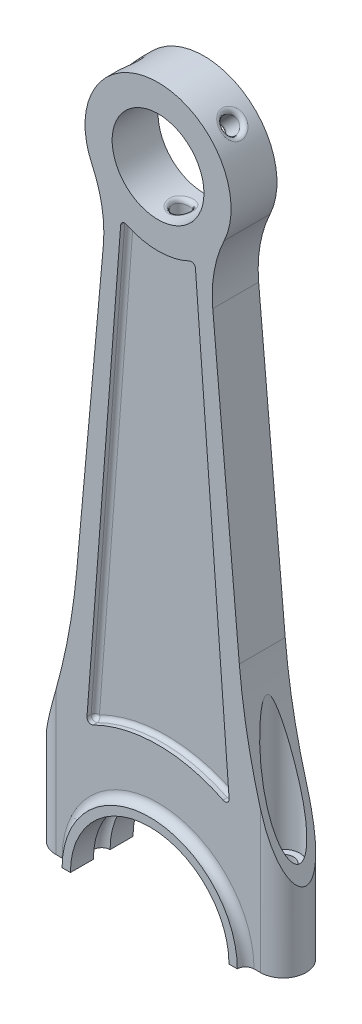
from build123d import *

# Parameters (mm, degrees)
SKETCH1_R               = 11
BOSS_EXTRUDE1_DEPTH     = 11
CUT_EXTRUDE1_START      = -2
CUT_EXTRUDE1_DEPTH      = 2
SKETCH3_R               = 2.5
CUT_EXTRUDE2_DEPTH      = 176.434460697
CUT_EXTRUDE3_START      = -20
SKETCH4_R               = 4
CUT_EXTRUDE3_DEPTH      = 156.43446072
BOSS_EXTRUDE2_DEPTH     = 2
FILLET1_R               = 2
SKETCH7_R               = 2
CUT_EXTRUDE4_REACH      = 177.571
CUT_EXTRUDE4_END_RADIUS = 11
SKETCH8_R               = 2
FILLET2_R               = 1
FILLET3_R               = 1
FILLET4_START           = -1
FILLET4_DEPTH           = 62.521512365
FILLET5_START           = -1
FILLET5_DEPTH           = 62.521512365


with BuildPart() as part:
    # Sketch1 → Boss-Extrude1 (new body)
    with BuildSketch(Plane.XY):
        with BuildLine():
            Line((30, 0), (30, 18))
            ThreePointArc((30, 18), (23.132621818, 39.37253177), (19.476303949, 61.521512265))
            Line((19.476303949, 61.521512265), (13.110138567, 132.100780215))
            ThreePointArc((13.110138567, 132.100780215), (13.445465667, 140.010108931), (15.837993998, 147.556348604))
            ThreePointArc((15.837993998, 147.556348604), (0, 172.5), (-15.837993998, 147.556348604))
            ThreePointArc((-15.837993998, 147.556348604), (-13.445465667, 140.010108931), (-13.110138567, 132.100780215))
            Line((-13.110138567, 132.100780215), (-19.476303949, 61.521512265))
            ThreePointArc((-19.476303949, 61.521512265), (-23.132621818, 39.37253177), (-30, 18))
            Line((-30, 18), (-30, 0))
            Line((-30, 0), (-19, 0))
            ThreePointArc((-19, 0), (0, 19), (19, 0))
            Line((19, 0), (30, 0))
        make_face()
        with Locations((0, 155)):
            Circle(SKETCH1_R, mode=Mode.SUBTRACT)
    extrude(amount=BOSS_EXTRUDE1_DEPTH)

    # Sketch2 → Cut-Extrude1 (cut)
    with BuildSketch(Plane.XY.offset(11).offset(CUT_EXTRUDE1_START)):
        with BuildLine():
            Line((8.847770254, 139.901425182), (17.173778182, 30.496907105))
            ThreePointArc((17.173778182, 30.496907105), (0, 35), (-17.173778182, 30.496907105))
            Line((-17.173778182, 30.496907105), (-8.847770254, 139.901425182))
            ThreePointArc((-8.847770254, 139.901425182), (0, 137.5), (8.847770254, 139.901425182))
        make_face()
    cut_extrude1 = extrude(amount=CUT_EXTRUDE1_DEPTH, mode=Mode.SUBTRACT)

    # Sketch3 → Cut-Extrude2 (cut, through all)
    with BuildSketch(Plane.XZ):
        with Locations(Location((24.5, 5.5, 0), (0, 0, 270))):
            Circle(SKETCH3_R)
        with Locations(Location((-24.5, 5.5, 0), (0, 0, 270))):
            Circle(SKETCH3_R)
    extrude(amount=-CUT_EXTRUDE2_DEPTH, mode=Mode.SUBTRACT)

    # Sketch4 → Cut-Extrude3 (cut, through all)
    with BuildSketch(Plane.XZ.offset(CUT_EXTRUDE3_START)):
        with Locations(Location((-24.5, 5.5, 0), (0, 0, 270))):
            Circle(SKETCH4_R)
        with Locations(Location((24.5, 5.5, 0), (0, 0, 270))):
            Circle(SKETCH4_R)
    extrude(amount=-CUT_EXTRUDE3_DEPTH, mode=Mode.SUBTRACT)

    # Sketch5 → Boss-Extrude2 (add)
    with BuildSketch(Plane.XY.offset(11)):
        with BuildLine():
            Line((-19, 0), (-21, 0))
            ThreePointArc((-21, 0), (0, 21), (21, 0))
            Line((21, 0), (19, 0))
            ThreePointArc((19, 0), (0, 19), (-19, 0))
        make_face()
    boss_extrude2 = extrude(amount=BOSS_EXTRUDE2_DEPTH)

    # Mirror3: Cut-Extrude1, Boss-Extrude2 across plane
    add(cut_extrude1.mirror(Plane.XY.offset(5.5)), mode=Mode.SUBTRACT)
    add(boss_extrude2.mirror(Plane.XY.offset(5.5)))

    # Fillet1
    fillet1_edges = [part.edges().sort_by_distance(p)[0] for p in [
        (0, 21, 11),
        (0, 21, 0),
    ]]
    fillet(fillet1_edges, radius=FILLET1_R - 0.0001)  # a hair under: the kernel refuses the full size

    # Sketch7 → Cut-Revolve1 (revolve, cut)
    with BuildSketch(Plane.XZ):
        with Locations((19, 5.5)):
            Circle(SKETCH7_R)
    revolve(axis=Axis((0, 0, 0), (0, 0, 1)), mode=Mode.SUBTRACT)

    # Cut-Extrude4: up to this cylinder (the profile starts outside it)
    cut_extrude4_end = Plane(origin=(0, 155, 5.5), z_dir=(0, 0, -1)) * Cylinder(CUT_EXTRUDE4_END_RADIUS, 378.142, mode=Mode.PRIVATE)
    # Sketch8 → Cut-Extrude4 (cut, up to the surface)
    with BuildSketch(Plane.XZ, mode=Mode.PRIVATE) as cut_extrude4_sk1:
        with Locations(Location((0, 5.5, 0), (0, 0, 270))):
            Circle(SKETCH8_R)
    cut_extrude4_tool1 = extrude(cut_extrude4_sk1.sketch, amount=-CUT_EXTRUDE4_REACH, mode=Mode.PRIVATE) - cut_extrude4_end
    add(cut_extrude4_tool1.solids().sort_by_distance((0, 0, 5.5))[0], mode=Mode.SUBTRACT)

    # Sketch10 → Cut-Revolve2 (revolve, cut)
    with BuildSketch(Plane.XY.offset(5.5), mode=Mode.PRIVATE) as cut_revolve2_sk:
        Polygon((-13.189827382, 168.189827382), (-6.374349559, 161.374349559), (-4.960135996, 162.788563121), (-11.77561382, 169.604040945), align=None)
    cut_revolve2 = revolve(cut_revolve2_sk.sketch.rotate(Axis((-13.189827382, 168.189827382, 5.5), (0.707106781186549, -0.7071067811865461, 0)), 180), axis=Axis((-13.189827382, 168.189827382, 5.5), (0.707106781186549, -0.7071067811865461, 0)), mode=Mode.SUBTRACT)

    # Mirror4: Cut-Revolve2 across plane
    add(cut_revolve2.mirror(Plane(origin=(0, 0, 0), x_dir=(0, 0, 1), z_dir=(1, 0, 0))), mode=Mode.SUBTRACT)

    # Fillet2
    fillet2_edges = [part.edges().sort_by_distance(p)[0] for p in [
        (0, 144.000000001, 7.500000012),
        (-6.23431569, 164.062742847, 5.499999999),
        (-10.879077291, 168.707504416, 5.500000003),
        (6.23431569, 164.062742847, 5.499999999),
        (10.879077291, 168.707504416, 5.500000003),
    ]]
    fillet(fillet2_edges, radius=FILLET2_R)

    # Fillet3
    fillet3_edges = [part.edges().sort_by_distance(p)[0] for p in [
        (-17.173778182, 30.496907105, 1),
        (17.173778182, 30.496907105, 1),
        (8.847770254, 139.901425182, 1),
        (-8.847770254, 139.901425182, 1),
        (0, 35, 2),
        (13.010774218, 85.199166143, 2),
        (0, 137.5, 2),
        (-13.010774218, 85.199166143, 2),
        (0, 35, 9),
        (17.173778182, 30.496907105, 10),
        (-13.010774218, 85.199166143, 9),
        (-17.173778182, 30.496907105, 10),
        (0, 137.5, 9),
        (-8.847770254, 139.901425182, 10),
        (13.010774218, 85.199166143, 9),
        (8.847770254, 139.901425182, 10),
    ]]
    fillet(fillet3_edges, radius=FILLET3_R)

    # Fillet4: read off the stored shape, not the designer's step
    # Fillet4 outline → Fillet4 (cut)
    with BuildSketch(Plane(origin=(0, 0, 0), x_dir=(1, 0, 0), z_dir=(0, 1, 0)).offset(FILLET4_START)):
        with BuildLine():
            ThreePointArc((24.5, 0), (28.389087297, -1.610912703), (30, -5.5))
            Line((30, -5.5), (30, 0))
            Line((30, 0), (24.5, 0))
        make_face()
        with BuildLine():
            ThreePointArc((30, -5.5), (28.389087297, -9.389087297), (24.5, -11))
            Line((24.5, -11), (30, -11))
            Line((30, -11), (30, -5.5))
        make_face()
    extrude(amount=FILLET4_DEPTH, mode=Mode.SUBTRACT)

    # Fillet5: read off the stored shape, not the designer's step
    # Fillet5 outline → Fillet5 (cut)
    with BuildSketch(Plane(origin=(0, 0, 0), x_dir=(1, 0, 0), z_dir=(0, 1, 0)).offset(FILLET5_START)):
        with BuildLine():
            Line((-30, -11), (-24.5, -11))
            ThreePointArc((-24.5, -11), (-28.389087297, -9.389087297), (-30, -5.5))
            Line((-30, -5.5), (-30, -11))
        make_face()
        with BuildLine():
            Line((-30, 0), (-30, -5.5))
            ThreePointArc((-30, -5.5), (-28.389087297, -1.610912703), (-24.5, 0))
            Line((-24.5, 0), (-30, 0))
        make_face()
    extrude(amount=FILLET5_DEPTH, mode=Mode.SUBTRACT)


solid = part.part
